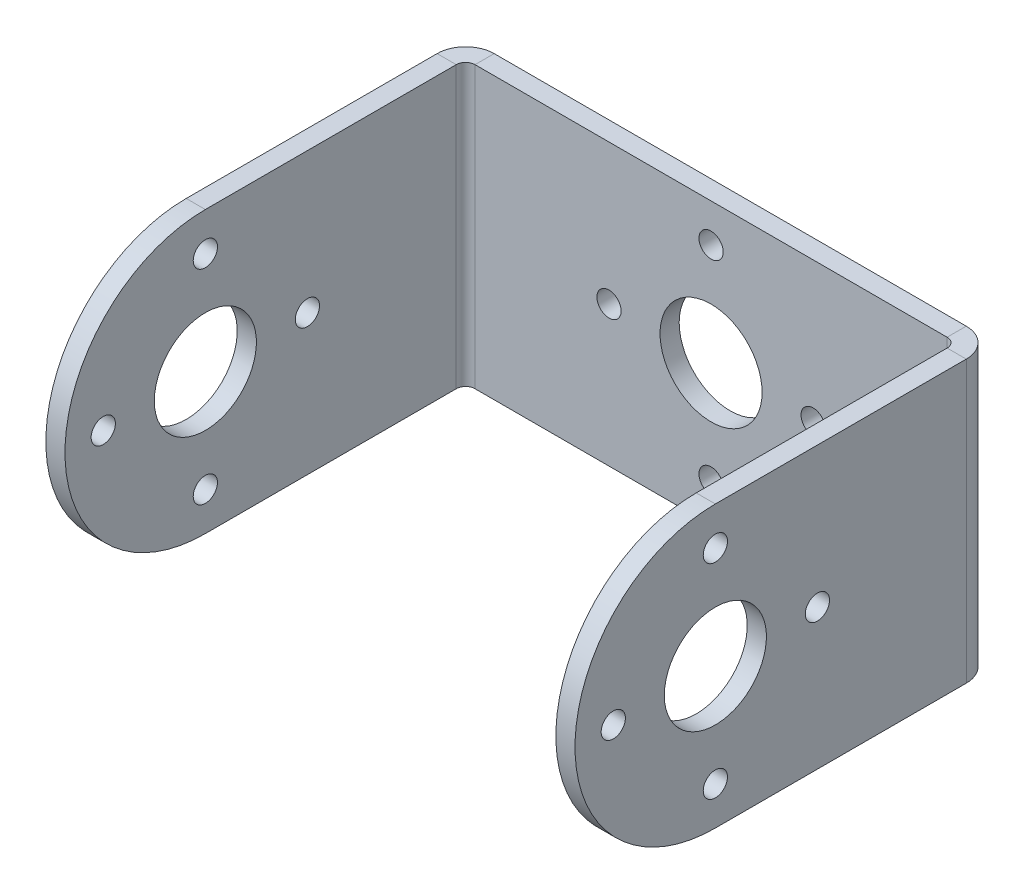
from build123d import *

# Parameters (mm, degrees)
SKETCH_1_W             = 103
SKETCH_1_H             = 22
SM_BASE_FLANGE_1_DEPTH = 1.5
OTHER_START            = -11
OTHER_1_DEPTH          = 22
OTHER_1_2_DEPTH        = 22
SKETCH_7_R             = 0.95
SKETCH_7_R_2           = 4
CUT_EXTRUDE_1_DEPTH    = 54.170270292
SKETCH_8_R             = 4
SKETCH_8_R_2           = 0.95
CUT_EXTRUDE_2_DEPTH    = 10


# Read off the part's stored shape, not the designer's step: 绘制的折弯1
# Sheet-metal steps are written as plain solids
with BuildPart() as part:
    # Sketch 1 → 基体-法兰1 (new body)
    with BuildSketch(Plane.XY):
        Rectangle(SKETCH_1_W, SKETCH_1_H)
    extrude(amount=-SM_BASE_FLANGE_1_DEPTH)

    # Other 1 outline → Other 1 (cut)
    with BuildSketch(Plane(origin=(0, 0, 0), x_dir=(1, 0, 0), z_dir=(0, 1, 0)).offset(OTHER_START)):
        with BuildLine():
            ThreePointArc((-20.611823856, 0), (-19.795164082, 1.086838938), (-18.5, 1.5))
            Line((-18.5, 1.5), (-51.5, 1.5))
            Line((-51.5, 1.5), (-51.5, 0))
            Line((-51.5, 0), (-20.611823856, 0))
        make_face()
        with BuildLine():
            Line((51.5, 1.5), (18.5, 1.5))
            ThreePointArc((18.5, 1.5), (19.795164082, 1.086838938), (20.611823856, 0))
            Line((20.611823856, 0), (51.5, 0))
            Line((51.5, 0), (51.5, 1.5))
        make_face()
    extrude(amount=OTHER_1_DEPTH, mode=Mode.SUBTRACT)

    # Other 1 2 outline → Other 1 2 (add)
    with BuildSketch(Plane(origin=(0, 0, 0), x_dir=(1, 0, 0), z_dir=(0, 1, 0)).offset(OTHER_START)):
        with BuildLine():
            Line((-18.5, 0), (-20.611823856, 0))
            ThreePointArc((-20.611823856, 0), (-20.705185343, -0.363053267), (-20.7366, -0.7366))
            Line((-20.7366, -0.7366), (-20.7366, -31.401454181))
            Line((-20.7366, -31.401454181), (-19.2366, -31.401454181))
            Line((-19.2366, -31.401454181), (-19.2366, -0.7366))
            ThreePointArc((-19.2366, -0.7366), (-19.020854855, -0.215745145), (-18.5, 0))
        make_face()
        with BuildLine():
            ThreePointArc((20.7366, -0.7366), (20.705185343, -0.363053267), (20.611823856, 0))
            Line((20.611823856, 0), (18.5, 0))
            ThreePointArc((18.5, 0), (19.020854855, -0.215745145), (19.2366, -0.7366))
            Line((19.2366, -0.7366), (19.2366, -31.401454181))
            Line((19.2366, -31.401454181), (20.7366, -31.401454181))
            Line((20.7366, -31.401454181), (20.7366, -0.7366))
        make_face()
    extrude(amount=OTHER_1_2_DEPTH)

    # 草图7 → 切除-拉伸1 (cut, through all)
    with BuildSketch(Plane.ZY.offset(20.7366)):
        with Locations((20.401454181, 8)):
            Circle(SKETCH_7_R)
        with Locations((12.401454181, 0)):
            Circle(SKETCH_7_R)
        with Locations((20.401454181, 0)):
            Circle(SKETCH_7_R_2)
        with Locations((28.401454181, 0)):
            Circle(SKETCH_7_R)
        with Locations((20.401454181, -8)):
            Circle(SKETCH_7_R)
        with BuildLine():
            ThreePointArc((20.401454181, 11), (28.179628774, 7.778174593), (31.401454181, 0))
            Line((31.401454181, 0), (31.401454181, 11))
            Line((31.401454181, 11), (20.401454181, 11))
        make_face()
        with BuildLine():
            Line((31.401454181, -11), (31.401454181, 0))
            ThreePointArc((31.401454181, 0), (28.179628774, -7.778174593), (20.401454181, -11))
            Line((20.401454181, -11), (31.401454181, -11))
        make_face()
    extrude(amount=-CUT_EXTRUDE_1_DEPTH, mode=Mode.SUBTRACT)

    # 草图8 → 切除-拉伸2 (cut)
    with BuildSketch(Plane.XY):
        Circle(SKETCH_8_R)
        with Locations((0, 8)):
            Circle(SKETCH_8_R_2)
        with Locations((8, 0)):
            Circle(SKETCH_8_R_2)
        with Locations((0, -8)):
            Circle(SKETCH_8_R_2)
        with Locations((-8, 0)):
            Circle(SKETCH_8_R_2)
    extrude(amount=-CUT_EXTRUDE_2_DEPTH, mode=Mode.SUBTRACT)


solid = part.part
